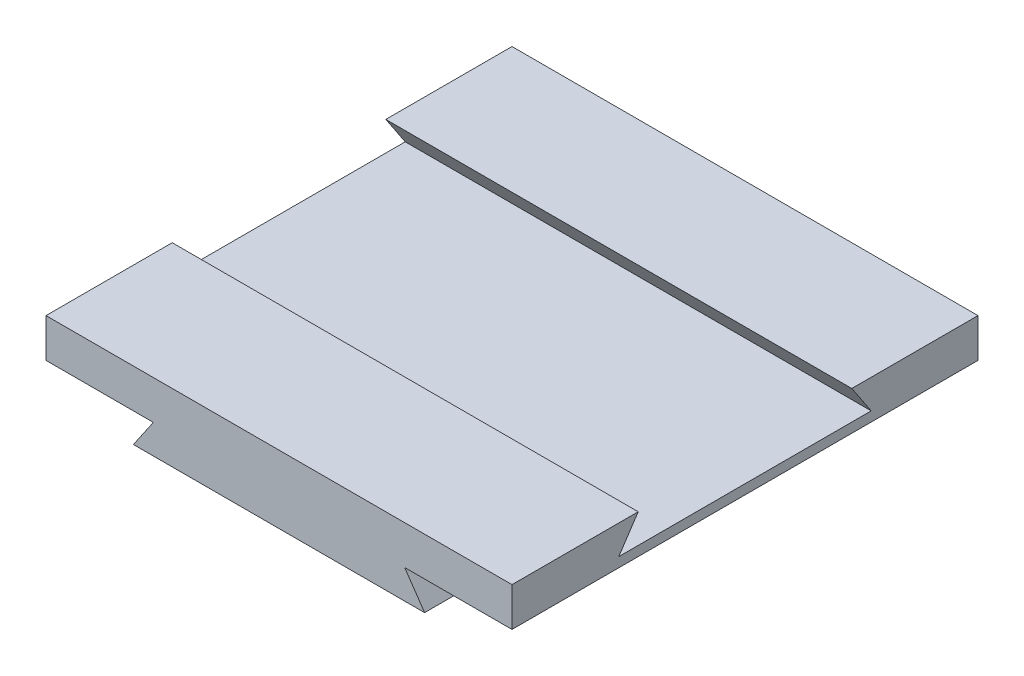
from build123d import *

# Parameters (mm, degrees)
EXTRUDE_1_DEPTH     = 240
CUT_EXTRUDE_1_DEPTH = 342.211078366


with BuildPart() as part:
    # Эскиз1 → Бобышка-Вытянуть1 (new body)
    with BuildSketch(Plane.XY):
        Polygon((0, 0), (75, 0), (64.72, 15), (120, 15), (120, 35), (0, 35), (-120, 35), (-120, 15), (-64.72, 15), (-75, 0), align=None)
    extrude(amount=EXTRUDE_1_DEPTH)

    # Эскиз2 → Вырез-Вытянуть1 (cut, through all)
    with BuildSketch(Plane.ZY.offset(120)):
        Polygon((65, 35), (175, 35), (185, 20), (55, 20), align=None)
    extrude(amount=-CUT_EXTRUDE_1_DEPTH, mode=Mode.SUBTRACT)


solid = part.part
